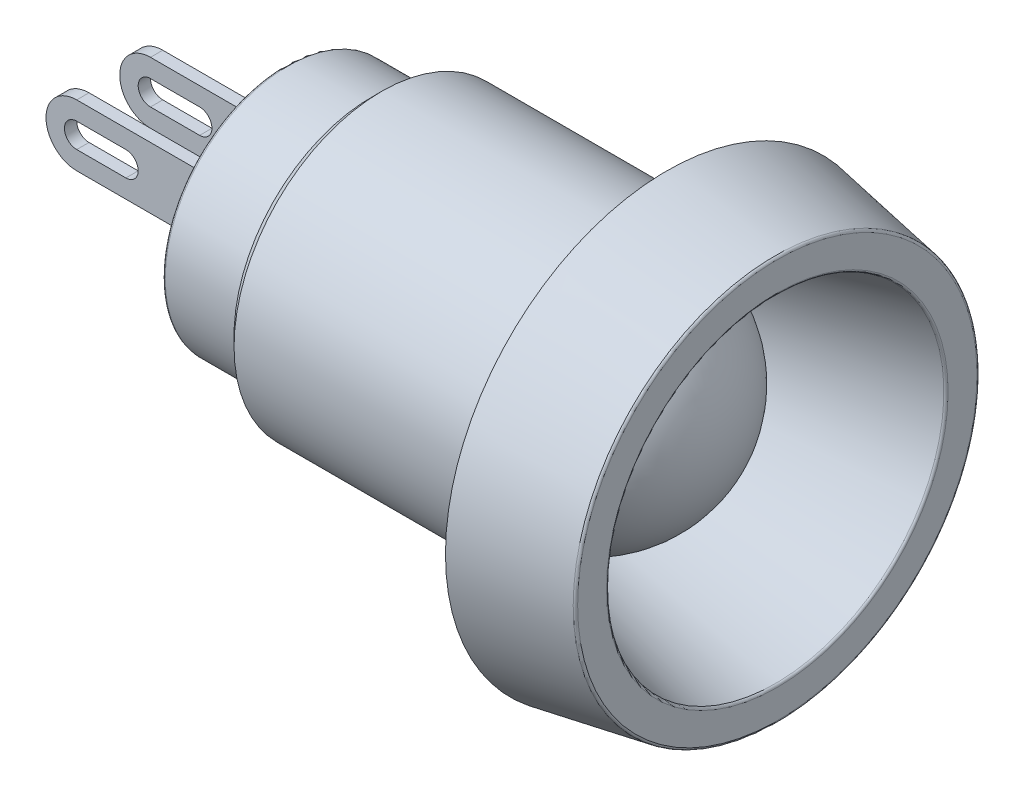
from build123d import *

# Parameters (mm, degrees)
CHAMFER_1_SIZE      = 0.4
FILLET_1_R          = 0.1
SKETCH_4_W          = 0.5
SKETCH_4_H          = 2.5
EXTRUDE_1_DEPTH     = 8
FILLET_2_R          = 1.25
CUT_EXTRUDE_1_DEPTH = 33.21121699


with BuildPart() as part:
    # Эскиз1 → Повернуть1 (revolve)
    with BuildSketch(Plane.XY, mode=Mode.PRIVATE) as revolve_1_sk:
        with BuildLine():
            Line((9, 0), (9, 5))
            Line((9, 5), (12.5, 5))
            Line((12.5, 5), (12.5, 6))
            Line((12.5, 6), (24.5, 6))
            Line((24.5, 6), (24.5, 9))
            Line((24.5, 9), (29, 8.206528587))
            Line((29, 8.206528587), (29, 6.869960021))
            Line((29, 6.869960021), (21.5, 5))
            ThreePointArc((21.5, 5), (25.035533906, 3.535533906), (26.5, 0))
            Line((26.5, 0), (9, 0))
        make_face()
    revolve(revolve_1_sk.sketch.rotate(Axis((9, 0, 0), (1, 0, 0)), 90), axis=Axis((9, 0, 0), (1, 0, 0)))

    # Фаска1
    chamfer_1_edges = [part.edges().sort_by_distance(p)[0] for p in [
        (12.5, 0, -6),
    ]]
    chamfer(chamfer_1_edges, length=CHAMFER_1_SIZE)

    # Скругление1
    fillet_1_edges = [part.edges().sort_by_distance(p)[0] for p in [
        (9, 0, -5),
        (29, 0, -6.869960021),
        (29, 0, -8.206528587),
    ]]
    fillet(fillet_1_edges, radius=FILLET_1_R)

    # Эскиз4 → Бобышка-Вытянуть1 (add)
    with BuildSketch(Plane.ZY.offset(-9)):
        with Locations((1.5, 0)):
            Rectangle(SKETCH_4_W, SKETCH_4_H)
        with Locations((-1.5, 0)):
            Rectangle(SKETCH_4_W, SKETCH_4_H)
    extrude(amount=EXTRUDE_1_DEPTH)

    # Скругление2
    fillet_2_edges = [part.edges().sort_by_distance(p)[0] for p in [
        (1, -1.25, 1.5),
        (1, -1.25, -1.5),
        (1, 1.25, 1.5),
        (1, 1.25, -1.5),
    ]]
    fillet(fillet_2_edges, radius=FILLET_2_R - 0.0001)  # a hair under: the kernel refuses the full size

    # Эскиз5 → Вырез-Вытянуть1 (cut, through all)
    with BuildSketch(Plane(origin=(0, 0, -1.75), x_dir=(-1, 0, 0), z_dir=(0, 0, -1))):
        with BuildLine():
            Line((-4.25, 0.5), (-2.25, 0.5))
            ThreePointArc((-2.25, 0.5), (-1.75, 0), (-2.25, -0.5))
            Line((-2.25, -0.5), (-4.25, -0.5))
            ThreePointArc((-4.25, -0.5), (-4.75, 0), (-4.25, 0.5))
        make_face()
    extrude(amount=-CUT_EXTRUDE_1_DEPTH, mode=Mode.SUBTRACT)


solid = part.part
